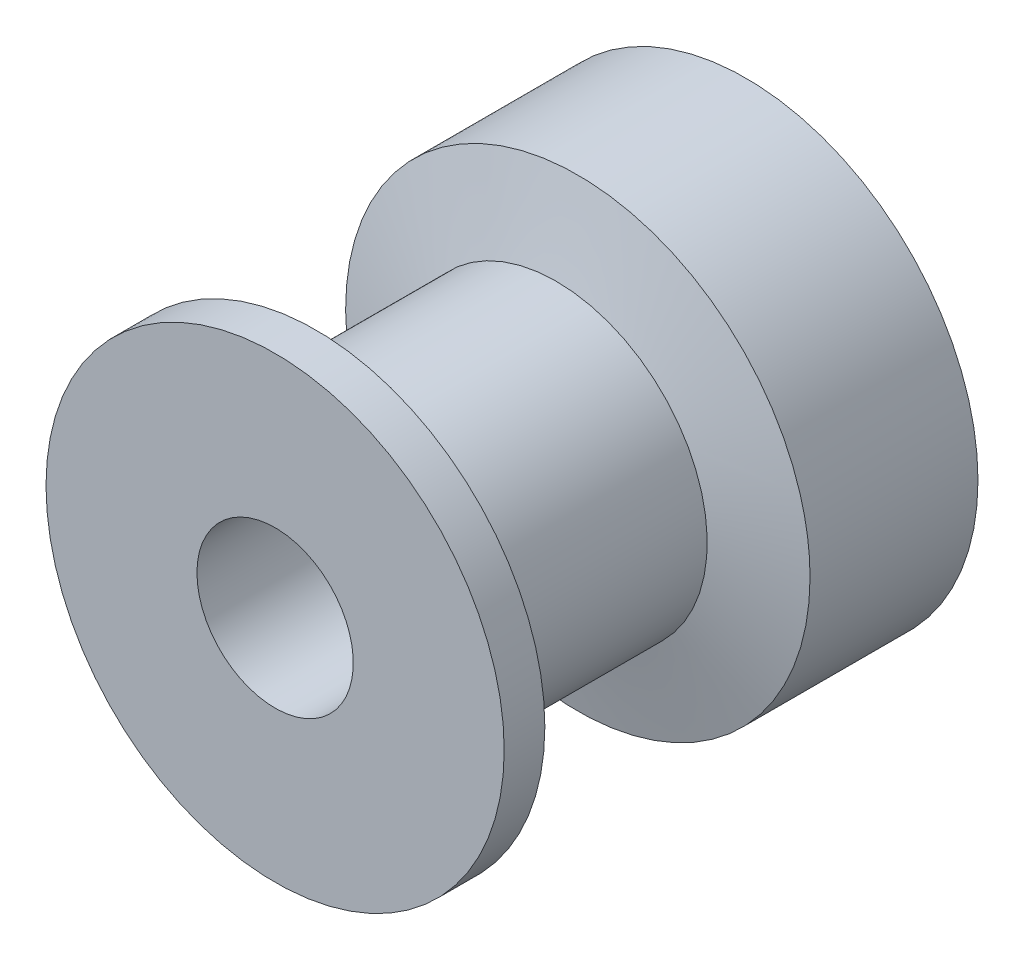
from build123d import *

# Parameters (mm, degrees)
SKETCH1_R           = 7.112
BOSS_EXTRUDE1_DEPTH = 5.1435
SKETCH2_2_R         = 4.6228
BOSS_EXTRUDE2_DEPTH = 7.366
SKETCH4_R           = 7.01675
BOSS_EXTRUDE3_DEPTH = 1.2446
SKETCH6_R           = 2.39395
CUT_EXTRUDE1_DEPTH  = 18.576657848


with BuildPart() as part:
    # Sketch1 → Boss-Extrude1 (new body)
    with BuildSketch(Plane.XY):
        Circle(SKETCH1_R)
    extrude(amount=-BOSS_EXTRUDE1_DEPTH)

    # Loft1: read off the stored shape, not the designer's step
    # Loft1: loft between two sections, ruled curve by curve
    loft1_from = [
        Edge.make_bspline([(6.805435292, 2.065573645, 0), (2.674288001, 15.67644423, 0), (-10.936582583, 11.545296939, 0), (-6.805435292, -2.065573645, 0), (-2.674288001, -15.67644423, 0), (10.936582583, -11.545296939, 0), (6.805435292, 2.065573645, 0)], [0, 0, 0, 0, 0.5, 0.5, 0.5, 1, 1, 1, 1], 3, [1, 0.333333333, 0.333333333, 1, 0.333333333, 0.333333333, 1]),
    ]
    loft1_to = [
        Edge.make_bspline([(4.035501617, 2.254995907, 0.6604), (-0.474490196, 10.325999141, 0.6604), (-8.54549343, 5.816007327, 0.6604), (-4.035501617, -2.254995907, 0.6604), (0.474490196, -10.325999141, 0.6604), (8.54549343, -5.816007327, 0.6604), (4.035501617, 2.254995907, 0.6604)], [0, 0, 0, 0, 0.5, 0.5, 0.5, 1, 1, 1, 1], 3, [1, 0.333333333, 0.333333333, 1, 0.333333333, 0.333333333, 1]),
    ]
    loft1 = Solid(Shell([*[Face.make_surface_from_curves(loft1_from[k], loft1_to[k]) for k in range(1)], Face(Wire(loft1_from)), Face(Wire(loft1_to))]))
    add(loft1)

    # Sketch2<2> → Boss-Extrude2 (add)
    with BuildSketch(Plane.XY.offset(0.6604)):
        with Locations(Location((0, 0, 0), (0, 0, 29.196))):
            Circle(SKETCH2_2_R)
    extrude(amount=BOSS_EXTRUDE2_DEPTH)

    # Sketch4 → Boss-Extrude3 (add)
    with BuildSketch(Plane.XY.offset(8.0264)):
        Circle(SKETCH4_R)
    extrude(amount=BOSS_EXTRUDE3_DEPTH)

    # Sketch6 → Cut-Extrude1 (cut, through all)
    with BuildSketch(Plane(origin=(0, 0, -5.1435), x_dir=(-1, 0, 0), z_dir=(0, 0, -1))):
        Circle(SKETCH6_R)
    extrude(amount=-CUT_EXTRUDE1_DEPTH, mode=Mode.SUBTRACT)


solid = part.part
